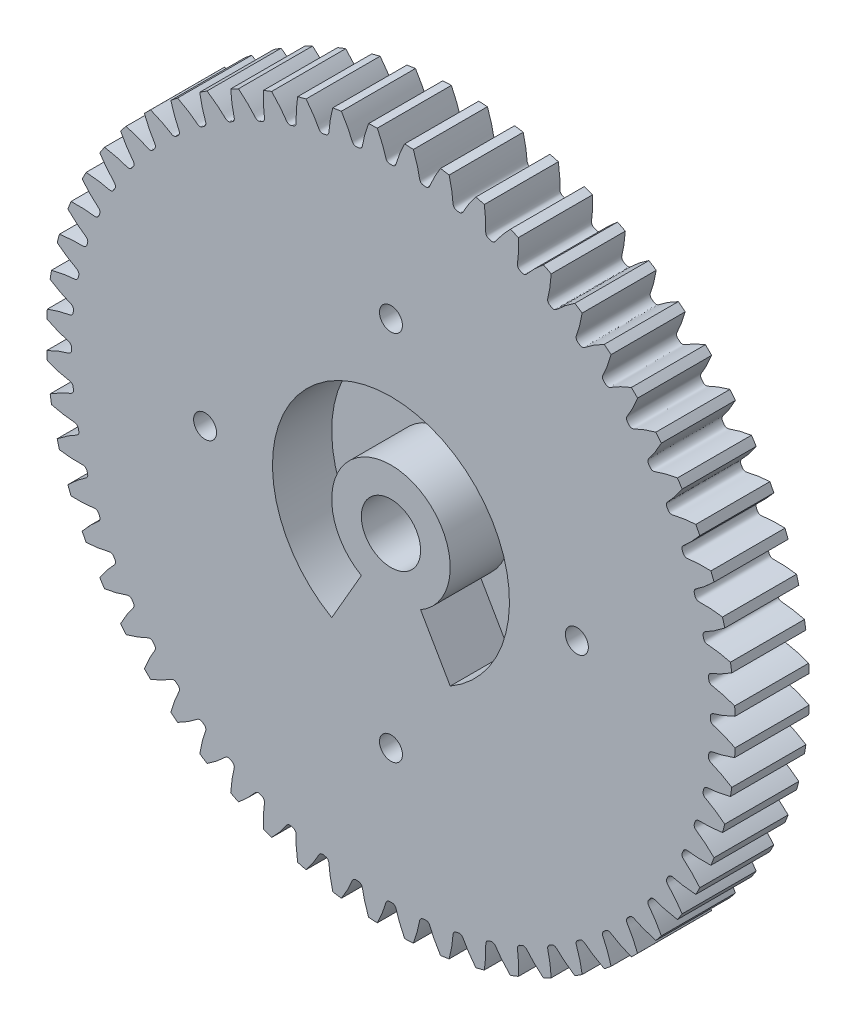
from build123d import *

# Parameters (mm, degrees)
SKETCHREVOLVESPURASSEMBLY01GEAR_W       = 10
SKETCHREVOLVESPURASSEMBLY01GEAR_H       = 46.499999302
TOOTHEXTRUDECUTSPURASSEMBLY01GEAR_DEPTH = 5
PATTERNSPURASSEMBLY01GEAR_COUNT         = 60
SKETCH5_R                               = 4
CUT_EXTRUDE2_DEPTH                      = 18
SKETCH6_R                               = 1.55
CUT_EXTRUDE3_DEPTH                      = 10
CIRPATTERN2_COUNT                       = 4
CUT_EXTRUDE4_DEPTH                      = 8
SKETCH7_R                               = 3
CUT_EXTRUDE5_DEPTH                      = 3


with BuildPart() as part:
    # SketchRevolveSpurAssembly01Gear → SpurAssembly01Gear (revolve)
    with BuildSketch(Plane(origin=(0, 0, 0), x_dir=(0, 0, -1), z_dir=(1, 0, 0))):
        with Locations((0, 23.249999651)):
            Rectangle(SKETCHREVOLVESPURASSEMBLY01GEAR_W, SKETCHREVOLVESPURASSEMBLY01GEAR_H)
    revolve(axis=Axis((0, 0, 0), (0, 0, -1)))

    # SketchToothSpurAssembly01Gear → ToothExtrudeCutSpurAssembly01Gear (cut, symmetric)
    with BuildSketch(Plane.XY):
        with BuildLine():
            ThreePointArc((46.536941888, 1.882445097), (46.574999301, 0), (46.536941888, -1.882445097))
            add(Edge.make_bspline(
                [(46.536941888, -1.882445097), (46.410580772, -1.817790323), (46.222345848, -1.724049646), (45.97247157, -1.604862074), (45.79126821, -1.520902479), (45.613955508, -1.441140119), (45.440604048, -1.365477285), (45.271282713, -1.293815196), (45.106058665, -1.226054069), (44.944997361, -1.162093066), (44.788162422, -1.101830604), (44.635616032, -1.045163354), (44.487417476, -0.991989937), (44.343628263, -0.942197901), (44.204293895, -0.895710038), (44.06950835, -0.852320586), (43.939186277, -0.812273822), (43.755364294, -0.756463501), (43.591162201, -0.718537687), (43.456933301, -0.660411719), (43.396978032, -0.628409971), (43.333262239, -0.585604909), (43.264730377, -0.524892475), (43.194956481, -0.436129591), (43.140009905, -0.315401482), (43.119097636, -0.163510161), (43.128214427, 0), (43.119097636, 0.163510161), (43.140009905, 0.315401482), (43.194956481, 0.436129591), (43.264730377, 0.524892475), (43.333262239, 0.585604909), (43.396978032, 0.628409971), (43.456933301, 0.660411719), (43.591162201, 0.718537687), (43.755364294, 0.756463501), (43.939186277, 0.812273822), (44.06950835, 0.852320586), (44.204293895, 0.895710038), (44.343628263, 0.942197901), (44.487417476, 0.991989937), (44.635616032, 1.045163354), (44.788162422, 1.101830604), (44.944997361, 1.162093066), (45.106058665, 1.226054069), (45.271282713, 1.293815196), (45.440604048, 1.365477285), (45.613955508, 1.441140119), (45.79126821, 1.520902479), (45.97247157, 1.604862074), (46.222345848, 1.724049646), (46.410580772, 1.817790323), (46.536941888, 1.882445097)],
                knots=[0, 0, 0, 0, 0.05176586, 0.076685537, 0.100963046, 0.124598386, 0.147591557, 0.16994256, 0.191651394, 0.21271806, 0.233142557, 0.252924885, 0.272065045, 0.290563036, 0.308418859, 0.325632513, 0.342203998, 0.358133315, 0.395728589, 0.403326908, 0.411414611, 0.420483419, 0.431260975, 0.444674611, 0.46138654, 0.478964563, 0.5, 0.521035437, 0.53861346, 0.555325389, 0.568739025, 0.579516581, 0.588585389, 0.596673092, 0.604271411, 0.641866685, 0.657796002, 0.674367487, 0.691581141, 0.709436964, 0.727934955, 0.747075115, 0.766857443, 0.78728194, 0.808348606, 0.83005744, 0.852408443, 0.875401614, 0.899036954, 0.923314463, 0.94823414, 1, 1, 1, 1], degree=3))
        make_face()
    toothextrudecutspurassembly01gear = extrude(amount=TOOTHEXTRUDECUTSPURASSEMBLY01GEAR_DEPTH, both=True, mode=Mode.SUBTRACT)

    # PatternSpurAssembly01Gear: ToothExtrudeCutSpurAssembly01Gear ×60 about axis
    patternspurassembly01gear_axis = Axis((0, 0, 5.5), (0, 0, -1))
    for i in range(1, PATTERNSPURASSEMBLY01GEAR_COUNT):
        add(toothextrudecutspurassembly01gear.rotate(patternspurassembly01gear_axis, i * 360 / PATTERNSPURASSEMBLY01GEAR_COUNT), mode=Mode.SUBTRACT)

    # Sketch5 → Cut-Extrude2 (cut)
    with BuildSketch(Plane(origin=(0, 0, -5), x_dir=(-1, 0, 0), z_dir=(0, 0, -1))):
        Circle(SKETCH5_R)
    extrude(amount=-CUT_EXTRUDE2_DEPTH, mode=Mode.SUBTRACT)

    # Sketch6 → Cut-Extrude3 (cut)
    with BuildSketch(Plane(origin=(0, 0, -5), x_dir=(-1, 0, 0), z_dir=(0, 0, -1))):
        with Locations((25.1, 0)):
            Circle(SKETCH6_R)
    cut_extrude3 = extrude(amount=-CUT_EXTRUDE3_DEPTH, mode=Mode.SUBTRACT)

    # CirPattern2: Cut-Extrude3 ×4 about axis
    cirpattern2_axis = Axis((0, 0, 5.5), (0, 0, -1))
    for i in range(1, CIRPATTERN2_COUNT):
        add(cut_extrude3.rotate(cirpattern2_axis, i * 360 / CIRPATTERN2_COUNT), mode=Mode.SUBTRACT)

    # Sketch4 → Cut-Extrude4 (cut)
    with BuildSketch(Plane.XY.offset(5)):
        with BuildLine():
            Line((-4, -6.92820323), (-8, -13.856406461))
            ThreePointArc((-8, -13.856406461), (0, 16), (8, -13.856406461))
            Line((8, -13.856406461), (4, -6.92820323))
            ThreePointArc((4, -6.92820323), (0, 8), (-4, -6.92820323))
        make_face()
    extrude(amount=-CUT_EXTRUDE4_DEPTH, mode=Mode.SUBTRACT)

    # Sketch7 → Cut-Extrude5 (cut)
    with BuildSketch(Plane(origin=(0, 0, -5), x_dir=(-1, 0, 0), z_dir=(0, 0, -1))):
        with Locations((-25.1, 0)):
            Circle(SKETCH7_R)
        with Locations((0, 25.1)):
            Circle(SKETCH7_R)
        with Locations((25.1, 0)):
            Circle(SKETCH7_R)
        with Locations((0, -25.1)):
            Circle(SKETCH7_R)
    extrude(amount=-CUT_EXTRUDE5_DEPTH, mode=Mode.SUBTRACT)


solid = part.part
